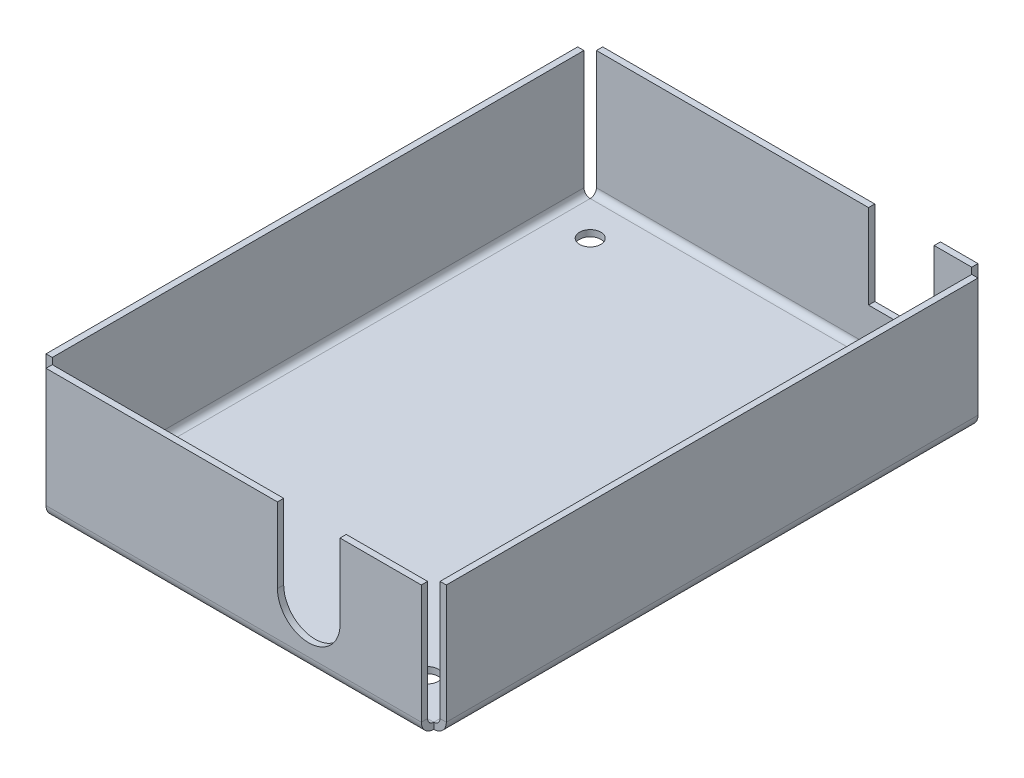
from build123d import *

# Parameters (mm, degrees)
SKETCH2_W          = 60
SKETCH2_H          = 1
BASE_FLANGE1_DEPTH = 85
EDGE_FLANGE1_DEPTH = 85
EDGE_FLANGE2_DEPTH = 85
EDGE_FLANGE3_DEPTH = 60
EDGE_FLANGE4_DEPTH = 60
CUT_EXTRUDE4_DEPTH = 1
SKETCH20_W         = 10.5
SKETCH20_H         = 13.5
CUT_EXTRUDE5_DEPTH = 1
SKETCH21_R         = 1.7
CUT_EXTRUDE6_DEPTH = 109.687625791


# Sheet-metal steps are written as plain solids
with BuildPart() as part:
    # Sketch2 → Base-Flange1 (new body)
    with BuildSketch(Plane.XY):
        with Locations((30, -0.5)):
            Rectangle(SKETCH2_W, SKETCH2_H)
    extrude(amount=BASE_FLANGE1_DEPTH)

    # Edge-Flange1 section (across the edge) → Edge-Flange1 (add)
    with BuildSketch(Plane(origin=(61, 0, 85), x_dir=(-1, 0, 0), z_dir=(0, 0, -1))):
        with BuildLine():
            Line((-1, 1), (-1, 20))
            Line((-1, 20), (0, 20))
            Line((0, 20), (0, 1))
            ThreePointArc((0, 1), (0.292893219, 0.292893219), (1, 0))
            Line((1, 0), (1, -1))
            ThreePointArc((1, -1), (-0.414213562, -0.414213562), (-1, 1))
        make_face()
    extrude(amount=EDGE_FLANGE1_DEPTH)

    # Edge-Flange2 section (across the edge) → Edge-Flange2 (add)
    with BuildSketch(Plane(origin=(-1, 0, 0), x_dir=(1, 0, 0), z_dir=(0, 0, 1))):
        with BuildLine():
            Line((-1, 1), (-1, 20))
            Line((-1, 20), (0, 20))
            Line((0, 20), (0, 1))
            ThreePointArc((0, 1), (0.292893219, 0.292893219), (1, 0))
            Line((1, 0), (1, -1))
            ThreePointArc((1, -1), (-0.414213562, -0.414213562), (-1, 1))
        make_face()
    extrude(amount=EDGE_FLANGE2_DEPTH)

    # Edge-Flange3 section (across the edge) → Edge-Flange3 (add)
    with BuildSketch(Plane(origin=(0, 0, 86), x_dir=(0, 0, -1), z_dir=(1, 0, 0))):
        with BuildLine():
            Line((-1, 1), (-1, 20))
            Line((-1, 20), (0, 20))
            Line((0, 20), (0, 1))
            ThreePointArc((0, 1), (0.292893219, 0.292893219), (1, 0))
            Line((1, 0), (1, -1))
            ThreePointArc((1, -1), (-0.414213562, -0.414213562), (-1, 1))
        make_face()
    extrude(amount=EDGE_FLANGE3_DEPTH)

    # Edge-Flange4 section (across the edge) → Edge-Flange4 (add)
    with BuildSketch(Plane(origin=(60, 0, -1), x_dir=(0, 0, 1), z_dir=(-1, 0, 0))):
        with BuildLine():
            Line((-1, 1), (-1, 20))
            Line((-1, 20), (0, 20))
            Line((0, 20), (0, 1))
            ThreePointArc((0, 1), (0.292893219, 0.292893219), (1, 0))
            Line((1, 0), (1, -1))
            ThreePointArc((1, -1), (-0.414213562, -0.414213562), (-1, 1))
        make_face()
    extrude(amount=EDGE_FLANGE4_DEPTH)

    # Sketch19 → Cut-Extrude4 (cut)
    with BuildSketch(Plane.XY.offset(87)):
        with BuildLine():
            Line((47, 20), (47, 8))
            ThreePointArc((47, 8), (42, 3), (37, 8))
            Line((37, 8), (37, 20))
            Line((37, 20), (47, 20))
        make_face()
    extrude(amount=-CUT_EXTRUDE4_DEPTH, mode=Mode.SUBTRACT)

    # Sketch20 → Cut-Extrude5 (cut)
    with BuildSketch(Plane.XY.offset(-1)):
        with Locations((48.75, 13.25)):
            Rectangle(SKETCH20_W, SKETCH20_H)
    extrude(amount=-CUT_EXTRUDE5_DEPTH, mode=Mode.SUBTRACT)

    # Sketch21 → Cut-Extrude6 (cut, through all)
    with BuildSketch(Plane(origin=(0, 0, 0), x_dir=(1, 0, 0), z_dir=(0, 1, 0))):
        with Locations(Location((5.5, -5.5, 0), (0, 0, 270))):
            Circle(SKETCH21_R)
        with Locations(Location((54.5, -5.5, 0), (0, 0, 270))):
            Circle(SKETCH21_R)
        with Locations(Location((53, -79, 0), (0, 0, 270))):
            Circle(SKETCH21_R)
        with Locations(Location((7, -79, 0), (0, 0, 270))):
            Circle(SKETCH21_R)
    extrude(amount=-CUT_EXTRUDE6_DEPTH, mode=Mode.SUBTRACT)


solid = part.part
